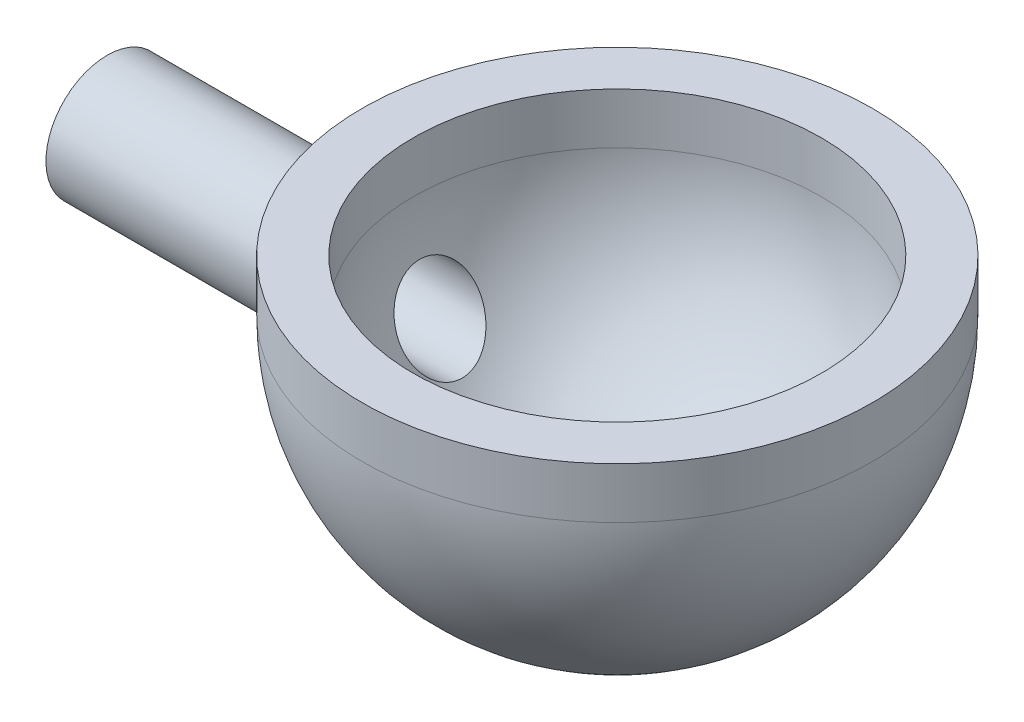
from build123d import *

# Parameters (mm, degrees)
BOSS_EXTRUDE1_REACH = 86.558
SKETCH2_R           = 6
CUT_EXTRUDE1_REACH  = 86.558
SKETCH4_R           = 4


with BuildPart() as part:
    # Sketch1 → Revolve1 (revolve)
    with BuildSketch(Plane.XY):
        with BuildLine():
            Line((20, 0), (20, -5))
            ThreePointArc((20, -5), (14.142135624, -19.142135624), (0, -25))
            Line((0, -25), (0, -30))
            ThreePointArc((0, -30), (17.67766953, -22.67766953), (25, -5))
            Line((25, -5), (25, 0))
            Line((25, 0), (20, 0))
        make_face()
    revolve(axis=Axis((0, 18.533057851, 0), (0, 1, 0)))

    # Sketch2 → Boss-Extrude1 (add, up to next)
    with BuildSketch(Plane(origin=(-50, 0, 0), x_dir=(0, 0, -1), z_dir=(1, 0, 0)), mode=Mode.PRIVATE) as boss_extrude1_sk1:
        with Locations((0, -14)):
            Circle(SKETCH2_R)
    boss_extrude1_tool1 = extrude(boss_extrude1_sk1.sketch, amount=BOSS_EXTRUDE1_REACH, mode=Mode.PRIVATE) - part.part
    add(boss_extrude1_tool1.solids().sort_by_distance((-50, -14, 0))[0])

    # Sketch4 → Cut-Extrude1 (cut, up to next)
    with BuildSketch(Plane.ZY.offset(50), mode=Mode.PRIVATE) as cut_extrude1_sk1:
        with Locations((0, -14)):
            Circle(SKETCH4_R)
    cut_extrude1_tool1 = extrude(cut_extrude1_sk1.sketch, amount=-CUT_EXTRUDE1_REACH, mode=Mode.PRIVATE) & part.part
    add(cut_extrude1_tool1.solids().sort_by_distance((-50, -14, 0))[0], mode=Mode.SUBTRACT)


solid = part.part
